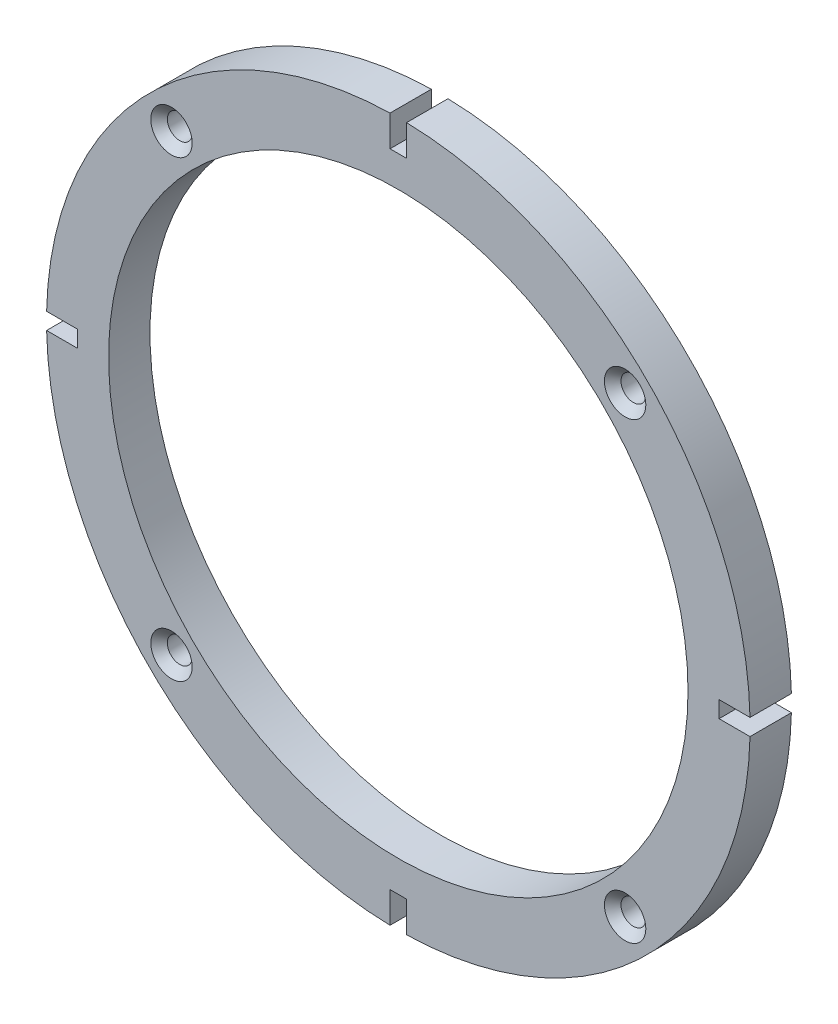
from build123d import *

# Parameters (mm, degrees)
SKETCH1_R                  = 70
BOSS_EXTRUDE1_DEPTH        = 10
SKETCH2_R                  = 3
WYTNIJ_WYCI_GNI_CIE1_DEPTH = 10
SZKIC1_R                   = 5
WYTNIJ_WYCI_GNI_CIE2_DEPTH = 2
SZYK_KO_OWY1_COUNT         = 4
SFAZOWANIE1_SIZE           = 2


with BuildPart() as part:
    # Sketch1 → Boss-Extrude1 (new body)
    with BuildSketch(Plane.XY):
        with BuildLine():
            ThreePointArc((2, -84.976467331), (60.104076401, -60.104076401), (84.976467331, -2))
            Line((84.976467331, -2), (77.499555144, -2))
            Line((77.499555144, -2), (77.499555144, 2))
            Line((77.499555144, 2), (84.976467331, 2))
            ThreePointArc((84.976467331, 2), (60.104076401, 60.104076401), (2, 84.976467331))
            Line((2, 84.976467331), (2, 77.499555144))
            Line((2, 77.499555144), (-2, 77.499555144))
            Line((-2, 77.499555144), (-2, 84.976467331))
            ThreePointArc((-2, 84.976467331), (-60.104076401, 60.104076401), (-84.976467331, 2))
            Line((-84.976467331, 2), (-77.499555144, 2))
            Line((-77.499555144, 2), (-77.499555144, -2))
            Line((-77.499555144, -2), (-84.976467331, -2))
            ThreePointArc((-84.976467331, -2), (-60.104076401, -60.104076401), (-2, -84.976467331))
            Line((-2, -84.976467331), (-2, -77.499555144))
            Line((-2, -77.499555144), (2, -77.499555144))
            Line((2, -77.499555144), (2, -84.976467331))
        make_face()
        Circle(SKETCH1_R, mode=Mode.SUBTRACT)
    extrude(amount=BOSS_EXTRUDE1_DEPTH)

    # Sketch2 → Wytnij-wyciągnięcie1 (cut)
    with BuildSketch(Plane(origin=(0, 0, 0), x_dir=(-1, 0, 0), z_dir=(0, 0, -1))):
        with Locations((-54.800775542, 54.800775542)):
            Circle(SKETCH2_R)
        with Locations((54.800775542, 54.800775542)):
            Circle(SKETCH2_R)
        with Locations((54.800775542, -54.800775542)):
            Circle(SKETCH2_R)
        with Locations((-54.800775542, -54.800775542)):
            Circle(SKETCH2_R)
    extrude(amount=-WYTNIJ_WYCI_GNI_CIE1_DEPTH, mode=Mode.SUBTRACT)

    # Szkic1 → Wytnij-wyciągnięcie2 (cut)
    with BuildSketch(Plane(origin=(0, 0, 0), x_dir=(-1, 0, 0), z_dir=(0, 0, -1))):
        with Locations((-54.800775542, 54.800775542)):
            Circle(SZKIC1_R)
    wytnij_wyci_gni_cie2 = extrude(amount=-WYTNIJ_WYCI_GNI_CIE2_DEPTH, mode=Mode.SUBTRACT)

    # Szyk kołowy1: Wytnij-wyciągnięcie2 ×4 about axis
    szyk_ko_owy1_axis = Axis((0, 0, 10), (0, 0, -1))
    for i in range(1, SZYK_KO_OWY1_COUNT):
        add(wytnij_wyci_gni_cie2.rotate(szyk_ko_owy1_axis, i * 360 / SZYK_KO_OWY1_COUNT), mode=Mode.SUBTRACT)

    # Sfazowanie1
    sfazowanie1_edges = [part.edges().sort_by_distance(p)[0] for p in [
        (57.800775542, -54.800775542, 10),
        (57.800775542, 54.800775542, 10),
        (-51.800775542, 54.800775542, 10),
        (-51.800775542, -54.800775542, 10),
    ]]
    chamfer(sfazowanie1_edges, length=SFAZOWANIE1_SIZE)


solid = part.part
